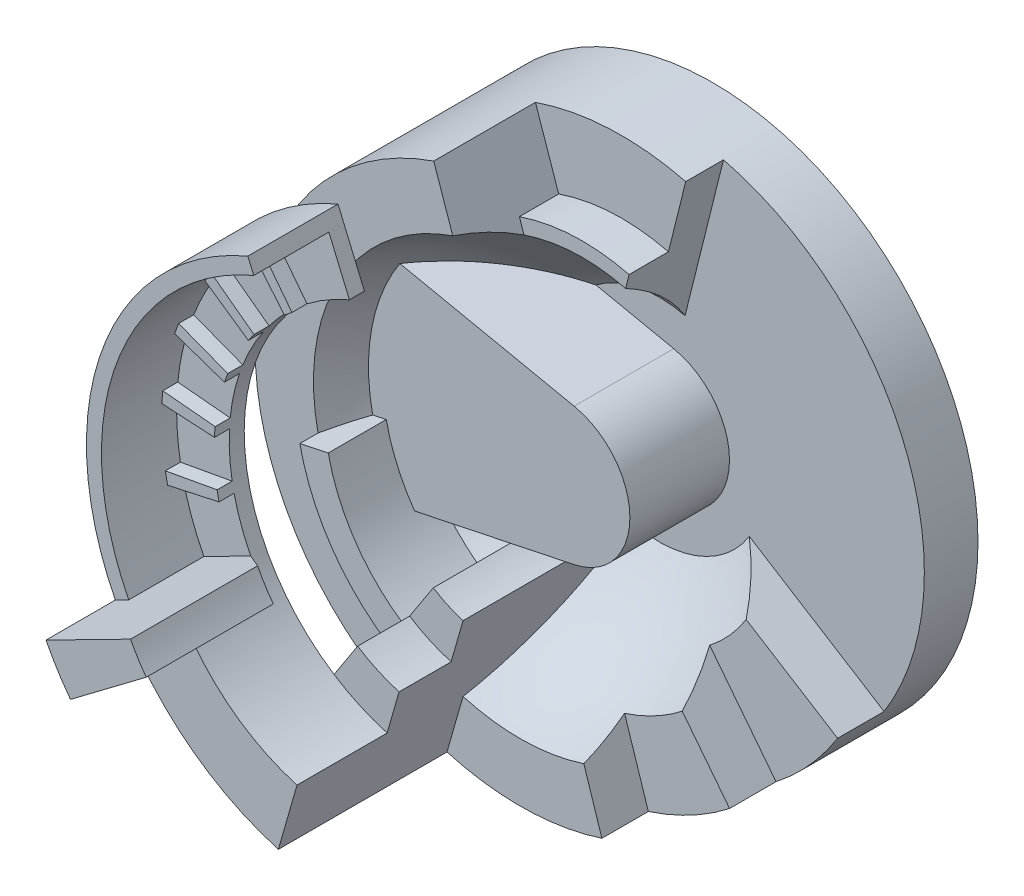
from build123d import *
from build123d.topology import SkipClean

# Parameters (mm, degrees)
BOSS_EXTRUDE1_DEPTH          = 35
SKETCH5_W                    = 110
SKETCH5_H                    = 110
BOSS_EXTRUDE2_DEPTH          = 55
BOSS_EXTRUDE3_DEPTH          = 10
FILLET1_R                    = 20
FILLET4_R                    = 10
SKETCH12_W                   = 221.575141924
SKETCH12_H                   = 185.580798287
CUT_REVOLVE1_ANGLE           = 32
CUT_REVOLVE1_OTHER_WAY_ANGLE = 109
BOSS_EXTRUDE4_REACH          = 690.076
SKETCH15_W                   = 208.026220801
SKETCH15_H                   = 123.720532191
CUT_REVOLVE2_ANGLE           = 20
SKETCH16_W                   = 103.379457842
SKETCH16_H                   = 185.232234629
CUT_REVOLVE3_ANGLE           = 20
SKETCH17_W                   = 90
SKETCH17_H                   = 120
REVOLVE3_ANGLE               = 74
REVOLVE3_OTHER_WAY_ANGLE     = 67
SKETCH18_W                   = 70
SKETCH18_H                   = 100
CUT_REVOLVE4_ANGLE           = 94
SKETCH19_W                   = 306.456266988
SKETCH19_H                   = 205.283587683
REVOLVE4_ANGLE               = 17
SKETCH20_W                   = 69.271583649
SKETCH20_H                   = 57.641793842
REVOLVE5_ANGLE               = 10
REVOLVE6_ANGLE               = 45
REVOLVE7_ANGLE               = 33
BOSS_EXTRUDE5_DEPTH          = 20
CIRPATTERN1_COUNT            = 5
CIRPATTERN1_ANGLE            = 62.64


with BuildPart() as part:
    # Sketch4 → Boss-Extrude1 (new body)
    with BuildSketch(Plane.XY.offset(90)):
        with BuildLine():
            ThreePointArc((18, 0), (12.727922061, 12.727922061), (0, 18))
            Line((0, 18), (-40, 18))
            Line((-40, 18), (-40, 0))
            Line((-40, 0), (-5, 0))
            ThreePointArc((-5, 0), (0, 5), (5, 0))
            Line((5, 0), (18, 0))
        make_face()
        with BuildLine():
            ThreePointArc((0, -18), (12.727922061, -12.727922061), (18, 0))
            Line((18, 0), (5, 0))
            ThreePointArc((5, 0), (0, -5), (-5, 0))
            Line((-5, 0), (-40, 0))
            Line((-40, 0), (-40, -18))
            Line((-40, -18), (0, -18))
        make_face()
    extrude(amount=-BOSS_EXTRUDE1_DEPTH)

    # Sketch5 → Boss-Extrude2 (add)
    with BuildSketch(Plane(origin=(0, 0, 55), x_dir=(-1, 0, 0), z_dir=(0, 0, -1))):
        with Locations((22, 0)):
            Rectangle(SKETCH5_W, SKETCH5_H)
    extrude(amount=BOSS_EXTRUDE2_DEPTH)

    # Sketch7 → Boss-Extrude3 (add)
    with BuildSketch(Plane(origin=(0, 0, 0), x_dir=(-1, 0, 0), z_dir=(0, 0, -1))):
        Polygon((87, -65), (125, -79.925557452), (125, 79.925557452), (87, 65), (-43, 65), (-43, -65), align=None)
    extrude(amount=-BOSS_EXTRUDE3_DEPTH)

    # Fillet1
    fillet1_edges = [part.edges().sort_by_distance(p)[0] for p in [
        (-125, -79.925557452, 5),
        (-87, -65, 5),
        (43, -65, 5),
        (43, 65, 5),
        (-87, 65, 5),
        (-125, 79.925557452, 5),
    ]]
    fillet(fillet1_edges, radius=FILLET1_R)

    # Fillet4
    fillet4_edges = [part.edges().sort_by_distance(p)[0] for p in [
        (-40, -18, 72.5),
        (-40, 18, 72.5),
        (33, 0, 55),
        (-22, -55, 55),
        (-77, 0, 55),
        (-22, 55, 55),
        (33, -55, 32.5),
        (33, 55, 32.5),
        (33, 0, 10),
        (-77, -55, 32.5),
        (-77, 55, 32.5),
        (-77, 0, 10),
        (-22, 55, 10),
        (-22, -55, 10),
    ]]
    fillet(fillet4_edges, radius=FILLET4_R - 0.0001)  # a hair under: the kernel refuses the full size


with BuildPart() as body_2:
    # Sketch8 → Revolve1 (revolve)
    with BuildSketch(Plane(origin=(0, 0, 0), x_dir=(1, 0, 0), z_dir=(0, 1, 0))):
        with BuildLine():
            Line((0, -474), (0, 204))
            ThreePointArc((0, 204), (339, -135), (0, -474))
        make_face()
    revolve(axis=Axis((0, 0, 474), (0, 0, -1)))


with BuildPart() as body_3:
    # Sketch9 → Revolve2 (revolve)
    with BuildSketch(Plane(origin=(0, 0, 0), x_dir=(0, 0, -1), z_dir=(1, 0, 0)), mode=Mode.PRIVATE) as revolve2_sk:
        with BuildLine():
            Line((0, 0), (0, -93.287808854))
            Line((0, -93.287808854), (132.583470884, -93.287808854))
            Line((132.583470884, -93.287808854), (132.583470884, -141.122377334))
            ThreePointArc((132.583470884, -141.122377334), (51.419403359, -224.141377396), (-52.997327403, -274.904617695))
            Line((-52.997327403, -274.904617695), (-52.997327403, -352.684487381))
            Line((-52.997327403, -352.684487381), (204, -352.684487381))
            Line((204, -352.684487381), (204, 0))
            Line((204, 0), (0, 0))
        make_face()
    revolve(revolve2_sk.sketch.rotate(Axis((0, 0, 0), (0, 0, -1)), 270), axis=Axis((0, 0, 0), (0, 0, -1)))

    # Sketch12 → Cut-Revolve1 (revolve, cut)
    with BuildSketch(Plane(origin=(0, 0, 0), x_dir=(1, 0, 0), z_dir=(0, 1, 0))):
        with Locations((241.896916419, 39.793071741)):
            Rectangle(SKETCH12_W, SKETCH12_H)
    revolve(axis=Axis((0, 0, 0), (0, 0, -1)), revolution_arc=CUT_REVOLVE1_ANGLE, mode=Mode.SUBTRACT)

    # Sketch12 → Cut-Revolve1 other way (revolve, cut)
    with BuildSketch(Plane(origin=(0, 0, 0), x_dir=(1, 0, 0), z_dir=(0, 1, 0))):
        with Locations((241.896916419, 39.793071741)):
            Rectangle(SKETCH12_W, SKETCH12_H)
    revolve(axis=Axis((0, 0, 0), (0, 0, 1)), revolution_arc=CUT_REVOLVE1_OTHER_WAY_ANGLE, mode=Mode.SUBTRACT)

    # Sketch14 → Boss-Extrude4 (add, up to next)
    with BuildSketch(Plane.XY, mode=Mode.PRIVATE) as boss_extrude4_sk1:
        with BuildLine():
            Line((19.076881684, -91.316416191), (-234.050666272, -144.197206796))
            ThreePointArc((-234.050666272, -144.197206796), (-274.904617695, 0), (-234.050666272, 144.197206796))
            Line((-234.050666272, 144.197206796), (19.076881684, 91.316416191))
            ThreePointArc((19.076881684, 91.316416191), (93.287808854, 0), (19.076881684, -91.316416191))
        make_face()
    boss_extrude4_tool1 = extrude(boss_extrude4_sk1.sketch, amount=-BOSS_EXTRUDE4_REACH, mode=Mode.PRIVATE) - body_3.part
    add(boss_extrude4_tool1.solids().sort_by_distance((-108.886341, 0, 0))[0])

    # Sketch15 → Cut-Revolve2 (revolve, cut)
    with BuildSketch(Plane(origin=(0, 0, 0), x_dir=(0.8480480961564173, -0.5299192642332188, 0), z_dir=(0.5299192642332188, 0.8480480961564173, 0))):
        with Locations((248.67137698, 8.862938693)):
            Rectangle(SKETCH15_W, SKETCH15_H)
    revolve(axis=Axis((0, 0, 0), (0, 0, -1)), revolution_arc=CUT_REVOLVE2_ANGLE, mode=Mode.SUBTRACT)

    # Sketch16 → Cut-Revolve3 (revolve, cut)
    with BuildSketch(Plane(origin=(0, 0, 0), x_dir=(0, 0, -1), z_dir=(0.7880107536067323, 0.6156614753256451, 0))):
        with Locations((-42.826790228, -260.068370066)):
            Rectangle(SKETCH16_W, SKETCH16_H)
    revolve(axis=Axis((0, 0, 0), (0, 0, -1)), revolution_arc=CUT_REVOLVE3_ANGLE, mode=Mode.SUBTRACT)



with BuildPart() as body_4:
    # Sketch17 → Revolve3 (revolve)
    with BuildSketch(Plane(origin=(0, 0, 0), x_dir=(1, 0, 0), z_dir=(0, 1, 0))):
        with Locations((-307.684487381, -217.442198662)):
            Rectangle(SKETCH17_W, SKETCH17_H)
    revolve(axis=Axis((0, 0, 0), (0, 0, 1)), revolution_arc=REVOLVE3_ANGLE)

    # Sketch17 → Revolve3 other way (revolve)
    with BuildSketch(Plane(origin=(0, 0, 0), x_dir=(1, 0, 0), z_dir=(0, 1, 0))):
        with Locations((-307.684487381, -217.442198662)):
            Rectangle(SKETCH17_W, SKETCH17_H)
    revolve(axis=Axis((0, 0, 0), (0, 0, -1)), revolution_arc=REVOLVE3_OTHER_WAY_ANGLE)

    # Sketch18 → Cut-Revolve4 (revolve, cut)
    with BuildSketch(Plane(origin=(0, 0, 0), x_dir=(0.3907311284892735, -0.9205048534524405, 0), z_dir=(0.9205048534524405, 0.3907311284892735, 0))):
        with Locations((-297.684487381, -227.442198662)):
            Rectangle(SKETCH18_W, SKETCH18_H)
    revolve(axis=Axis((0, 0, 0), (0, 0, 1)), revolution_arc=CUT_REVOLVE4_ANGLE, mode=Mode.SUBTRACT)


with BuildPart() as body_3_1:
    with SkipClean():  # the faces are left unmerged after this step: merging them gives an invalid solid
        add(body_3.part)

        add(body_4.part)  # Revolve4 merges body 4
        # Sketch19 → Revolve4 (revolve)
        with BuildSketch(Plane(origin=(0, 0, 0), x_dir=(0, 0, -1), z_dir=(0.9612616959383228, -0.2756373558169854, 0))):
            with Locations((-4.214065168, -250.04269354)):
                Rectangle(SKETCH19_W, SKETCH19_H)
        revolve(axis=Axis((0, 0, 0), (0, 0, -1)), revolution_arc=REVOLVE4_ANGLE)

    # Sketch20 → Cut-Revolve5 (revolve, cut)
    with SkipClean():  # the faces are left unmerged after this step: merging them gives an invalid solid
        with BuildSketch(Plane(origin=(0, 0, 0), x_dir=(0, 0, -1), z_dir=(0.9612616959383229, -0.27563735581698545, 0)), mode=Mode.PRIVATE) as cut_revolve5_sk:
            with Locations((-122.806406838, -176.221796619)):
                Rectangle(SKETCH20_W, SKETCH20_H)
        revolve(cut_revolve5_sk.sketch.rotate(Axis((0, 0, 0), (0, 0, 1)), 286), axis=Axis((0, 0, 0), (0, 0, 1)), mode=Mode.SUBTRACT)

    # Sketch21 → Revolve5 (revolve)
    with SkipClean():  # the faces are left unmerged after this step: merging them gives an invalid solid
        with BuildSketch(Plane(origin=(0, 0, 0), x_dir=(0.8910065241883608, 0.4539904997395606, 0), z_dir=(-0.4539904997395606, 0.8910065241883608, 0))):
            Polygon((-352.684487381, -177.442198662), (-262.684487381, -177.442198662), (-226.3635331, -200.635504694), (-226.3635331, -369.727899201), (-352.684487381, -369.727899201), align=None)
        revolve(axis=Axis((0, 0, 0), (0, 0, 1)), revolution_arc=REVOLVE5_ANGLE)

    # Sketch23 → Revolve6 (revolve)
    with SkipClean():  # the faces are left unmerged after this step: merging them gives an invalid solid
        with BuildSketch(Plane(origin=(0, 0, 0), x_dir=(0, 0, 1), z_dir=(-0.838670567945428, 0.5446390350150208, 0))):
            with BuildLine():
                Line((52.997327403, -274.904617695), (77.16647828, -274.904617695))
                Line((77.16647828, -274.904617695), (77.16647828, -236.215399807))
                Line((77.16647828, -236.215399807), (-33.492204466, -236.215399807))
                ThreePointArc((-33.492204466, -236.215399807), (8.394219656, -258.596574335), (52.997327403, -274.904617695))
            make_face()
        revolve(axis=Axis((0, 0, 0), (0, 0, -1)), revolution_arc=REVOLVE6_ANGLE)

    # Sketch24 → Revolve7 (revolve)
    with SkipClean():  # the faces are left unmerged after this step: merging them gives an invalid solid
        with BuildSketch(Plane(origin=(0, 0, 0), x_dir=(0, 0, -1), z_dir=(0.9455185755993164, 0.3255681544571581, 0))):
            with BuildLine():
                Line((29.947951331, 238.411319514), (29.947951331, 257.387120756))
                Line((29.947951331, 257.387120756), (82.325244386, 257.387120756))
                Line((82.325244386, 257.387120756), (82.325244386, 352.684487381))
                Line((82.325244386, 352.684487381), (132.583470884, 352.684487381))
                Line((132.583470884, 352.684487381), (132.583470884, 141.122377334))
                ThreePointArc((132.583470884, 141.122377334), (86.395300565, 195.178337821), (29.947951331, 238.411319514))
            make_face()
        revolve(axis=Axis((0, 0, 0), (0, 0, -1)), revolution_arc=REVOLVE7_ANGLE)

    # Sketch25 → Boss-Extrude5 (add)
    with SkipClean():  # the faces are left unmerged after this step: merging them gives an invalid solid
        with BuildSketch(Plane.XY.offset(177.442198662)):
            with BuildLine():
                Line((-324.592860019, -72.927658462), (-256.207891235, -57.971168522))
                ThreePointArc((-256.207891235, -57.971168522), (-257.559046392, -51.637946631), (-258.753675036, -45.273342779))
                Line((-258.753675036, -45.273342779), (-327.618959516, -57.834120637))
                ThreePointArc((-327.618959516, -57.834120637), (-326.193222042, -65.398394765), (-324.592860019, -72.927658462))
            make_face()
        boss_extrude5 = extrude(amount=BOSS_EXTRUDE5_DEPTH)

    # CirPattern1: Boss-Extrude5 ×5 about axis
    cirpattern1_axis = Axis((0, 0, 0), (0, 0, -1))
    for i in range(1, CIRPATTERN1_COUNT):
        add(boss_extrude5.rotate(cirpattern1_axis, i * CIRPATTERN1_ANGLE / (CIRPATTERN1_COUNT - 1)))


solid = body_3_1.part
